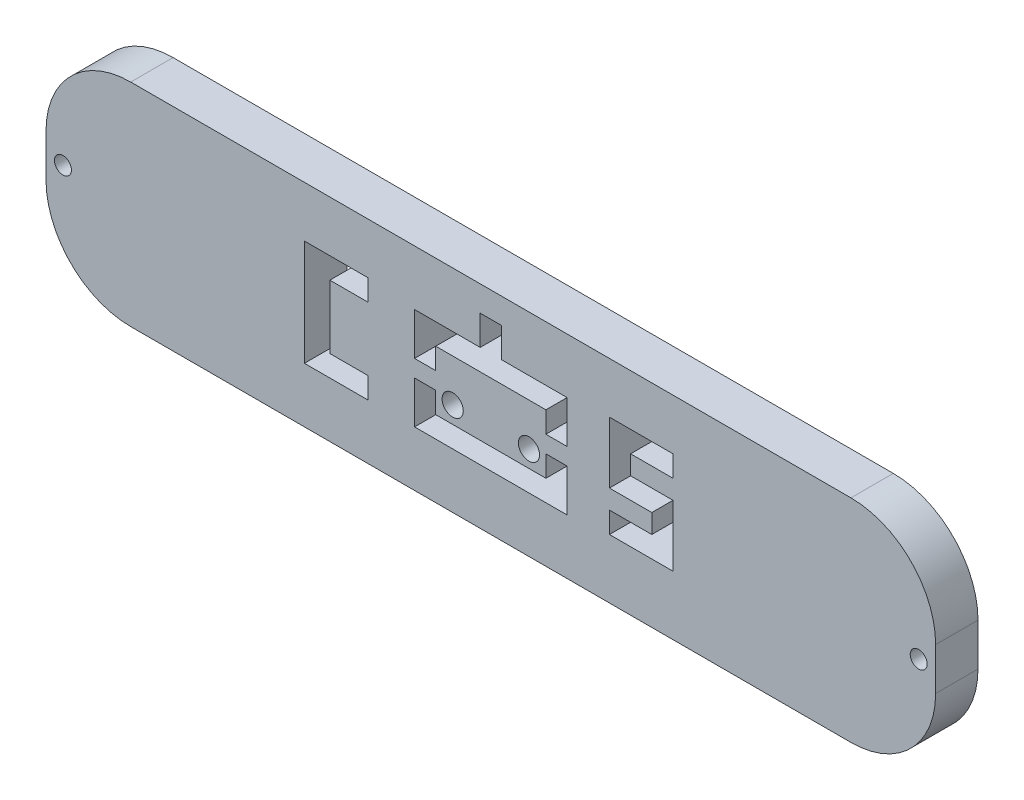
from build123d import *

# Parameters (mm, degrees)
CROQUIS1_W              = 210
CROQUIS1_H              = 50
CROQUIS1_R              = 2.5
CROQUIS1_R_2            = 2
SALIENTE_EXTRUIR1_DEPTH = 10
REDONDEO1_R             = 20


with BuildPart() as part:
    # Croquis1 → Saliente-Extruir1 (new body)
    with BuildSketch(Plane.XY):
        with Locations((105, -25)):
            Rectangle(CROQUIS1_W, CROQUIS1_H)
        with Locations((96, -28)):
            Circle(CROQUIS1_R, mode=Mode.SUBTRACT)
        Polygon((118, -27), (123, -27), (123, -32), (123, -37), (118, -37), (92, -37), (87, -37), (87, -32), (87, -27), (92, -27), (92, -32), (118, -32), align=None, mode=Mode.SUBTRACT)
        with Locations((114, -28)):
            Circle(CROQUIS1_R, mode=Mode.SUBTRACT)
        with Locations((4, -25)):
            Circle(CROQUIS1_R_2, mode=Mode.SUBTRACT)
        Polygon((67, -12), (76, -12), (76, -17), (67, -17), (67, -32), (76, -32), (76, -37), (67, -37), (61, -37), (61, -32), (61, -17), (61, -12), align=None, mode=Mode.SUBTRACT)
        Polygon((138, -12), (148, -12), (148, -17), (138, -17), (138, -21.5), (143, -21.5), (148, -21.5), (148, -26.5), (148, -31), (148, -36), (133, -36), (133, -31), (143, -31), (143, -26.5), (138, -26.5), (133, -26.5), (133, -21.5), (133, -17), (133, -12), align=None, mode=Mode.SUBTRACT)
        Polygon((87, -18), (87, -13), (92, -13), (102.5, -13), (102.5, -6), (107.5, -6), (107.5, -13), (118, -13), (123, -13), (123, -18), (123, -23), (118, -23), (118, -18), (107.5, -18), (102.5, -18), (92, -18), (92, -23), (87, -23), align=None, mode=Mode.SUBTRACT)
        with Locations((206, -25)):
            Circle(CROQUIS1_R_2, mode=Mode.SUBTRACT)
    extrude(amount=SALIENTE_EXTRUIR1_DEPTH)

    # Redondeo1
    redondeo1_edges = [part.edges().sort_by_distance(p)[0] for p in [
        (210, 0, 5),
        (210, -50, 5),
        (0, -50, 5),
        (0, 0, 5),
    ]]
    fillet(redondeo1_edges, radius=REDONDEO1_R)


solid = part.part
